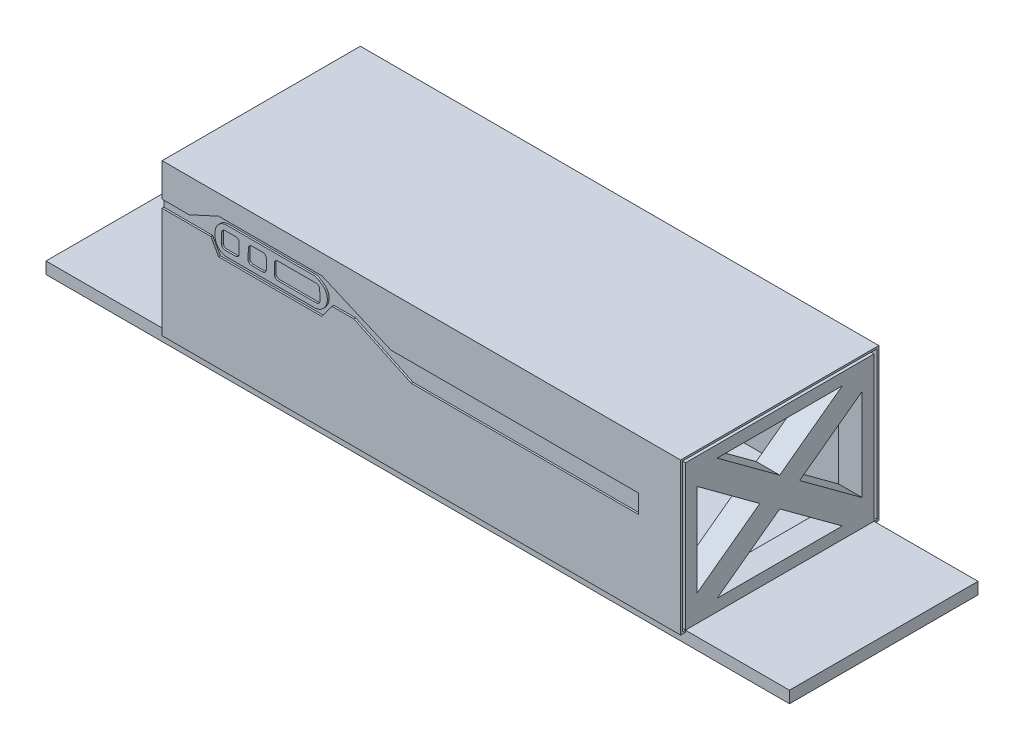
from build123d import *

# Parameters (mm, degrees)
BOSS_EXTRUDE1_DEPTH      = 80
BOSS_EXTRUDE1_DEPTH_BACK = 80
SKETCH7_W                = 630.907220272
SKETCH7_H                = 10
SKETCH11_W               = 20
SKETCH11_H               = 160
BOSS_EXTRUDE2_DEPTH      = 123
CUT_EXTRUDE1_DEPTH       = 20
LPATTERN2_COUNT          = 3
LPATTERN2_PITCH          = 210
THICKEN1_START           = -528.249890188
THICKEN1_DEPTH           = 440
CUT_EXTRUDE2_DEPTH       = 1.5


# Read off the part's stored shape, not the designer's step: Thicken1
with BuildPart() as part:
    # Sketch7 → Boss-Extrude1 (new, two sides: drawn at the far end of the back side and taken through both)
    with BuildSketch(Plane.XY.offset(-BOSS_EXTRUDE1_DEPTH_BACK)):
        with Locations((-315.453610136, 440.692410893)):
            Rectangle(SKETCH7_W, SKETCH7_H)
    extrude(amount=BOSS_EXTRUDE1_DEPTH + BOSS_EXTRUDE1_DEPTH_BACK)

    # Sketch11 → Boss-Extrude2 (add)
    with BuildSketch(Plane(origin=(0, 445.692410893, 0), x_dir=(1, 0, 0), z_dir=(0, 1, 0))):
        with Locations((-98.249890188, 0)):
            Rectangle(SKETCH11_W, SKETCH11_H)
    boss_extrude2 = extrude(amount=BOSS_EXTRUDE2_DEPTH)

    # Sketch22 → Cut-Extrude1 (cut)
    with BuildSketch(Plane(origin=(-88.249890188, 0, 0), x_dir=(0, 0, -1), z_dir=(1, 0, 0))):
        Polygon((16.87450142, 507.192410893), (70, 468.107222652), (70, 546.277599133), align=None)
        Polygon((0, 494.777599133), (-53.12549858, 455.692410893), (53.12549858, 455.692410893), align=None)
        Polygon((53.12549858, 558.692410893), (0, 519.607222652), (-53.12549858, 558.692410893), align=None)
        Polygon((-70, 546.277599133), (-16.87450142, 507.192410893), (-70, 468.107222652), align=None)
    cut_extrude1 = extrude(amount=-CUT_EXTRUDE1_DEPTH, mode=Mode.SUBTRACT)

    # LPattern2: Boss-Extrude2, Cut-Extrude1 ×3
    with Locations(*[(-i * LPATTERN2_PITCH, 0, 0) for i in range(1, LPATTERN2_COUNT)]):
        add(boss_extrude2)
        add(cut_extrude1, mode=Mode.SUBTRACT)

    # Thicken1 outline → Thicken1 (add)
    with BuildSketch(Plane.YZ.offset(THICKEN1_START)):
        Polygon((572.792410893, 84.1), (444.092410893, 84.1), (444.092410893, 80), (445.692410893, 80), (445.692410893, 82.5), (571.192410893, 82.5), (571.192410893, -82.5), (445.692410893, -82.5), (445.692410893, -80), (444.092410893, -80), (444.092410893, -84.1), (572.792410893, -84.1), align=None)
    extrude(amount=THICKEN1_DEPTH)

    # Sketch32 → Cut-Extrude2 (cut)
    # profile 1 of 4: a face of its own
    with BuildSketch(Plane.XY.offset(84.1)):
        Polygon((-528.249890188, 544.469331624), (-528.249890188, 537.802237514), (-486.889483608, 537.802237514), (-480.302440914, 526.060117929), (-392.666133771, 526.060117929), (-384.074338953, 537.802237514), (-365.458783514, 537.802237514), (-316.771946211, 514.890784666), (-123.815009115, 514.890784666), (-123.815009115, 530.653531113), (-334.107361199, 530.653531113), (-392.666133771, 555.945540522), (-480.302440914, 555.945540522), (-505.270533493, 544.469331624), align=None)
        with BuildLine():
            ThreePointArc((-479.595619768, 550.590513801), (-476.634482688, 552.254570361), (-473.28714986, 552.831441214))
            Line((-473.28714986, 552.831441214), (-400.440970209, 552.831441214))
            ThreePointArc((-400.440970209, 552.831441214), (-397.496952722, 552.38825873), (-394.813882632, 551.097993421))
            Line((-394.813882632, 551.097993421), (-392.4594665, 549.495329404))
            ThreePointArc((-392.4594665, 549.495329404), (-389.247128875, 545.90473294), (-388.086554076, 541.228777196))
            Line((-388.086554076, 541.228777196), (-388.086554076, 540.483912543))
            ThreePointArc((-388.086554076, 540.483912543), (-388.52973656, 537.539895057), (-389.820001869, 534.856824966))
            Line((-389.820001869, 534.856824966), (-390.557736537, 533.773045468))
            ThreePointArc((-390.557736537, 533.773045468), (-394.148333001, 530.560707843), (-398.824288745, 529.400133044))
            Line((-398.824288745, 529.400133044), (-473.046485096, 529.400133044))
            ThreePointArc((-473.046485096, 529.400133044), (-477.342721875, 530.370052782), (-480.805557683, 533.091663137))
            Line((-480.805557683, 533.091663137), (-481.107636182, 533.463203151))
            ThreePointArc((-481.107636182, 533.463203151), (-482.771692743, 536.424340231), (-483.348563595, 539.771673059))
            Line((-483.348563595, 539.771673059), (-483.348563595, 542.781509125))
            ThreePointArc((-483.348563595, 542.781509125), (-482.378643857, 547.077745904), (-479.657033503, 550.540581713))
            Line((-479.657033503, 550.540581713), (-479.595619768, 550.590513801))
        make_face(mode=Mode.SUBTRACT)
    # profile 2 of 4: a face of its own
    with BuildSketch(Plane.XY.offset(84.1)):
        with BuildLine():
            ThreePointArc((-462.90275949, 536.708267271), (-463.781439147, 534.586946927), (-465.90275949, 533.708267271))
            Line((-465.90275949, 533.708267271), (-474.804180104, 533.708267271))
            ThreePointArc((-474.804180104, 533.708267271), (-476.925500448, 534.586946927), (-477.804180104, 536.708267271))
            Line((-477.804180104, 536.708267271), (-477.804180104, 545.106288017))
            ThreePointArc((-477.804180104, 545.106288017), (-476.925500448, 547.227608361), (-474.804180104, 548.106288017))
            Line((-474.804180104, 548.106288017), (-465.90275949, 548.106288017))
            ThreePointArc((-465.90275949, 548.106288017), (-463.781439147, 547.227608361), (-462.90275949, 545.106288017))
            Line((-462.90275949, 545.106288017), (-462.90275949, 536.708267271))
        make_face()
    # profile 3 of 4: a face of its own
    with BuildSketch(Plane.XY.offset(84.1)):
        with BuildLine():
            ThreePointArc((-439.852717102, 536.708267271), (-440.731396759, 534.586946927), (-442.852717102, 533.708267271))
            Line((-442.852717102, 533.708267271), (-452.341688786, 533.708267271))
            ThreePointArc((-452.341688786, 533.708267271), (-454.496780659, 534.62126487), (-455.340143394, 536.804547923))
            Line((-455.340143394, 536.804547923), (-455.070482178, 545.20256867))
            ThreePointArc((-455.070482178, 545.20256867), (-454.15902997, 547.26137989), (-452.07202757, 548.106288017))
            Line((-452.07202757, 548.106288017), (-442.852717102, 548.106288017))
            ThreePointArc((-442.852717102, 548.106288017), (-440.731396759, 547.227608361), (-439.852717102, 545.106288017))
            Line((-439.852717102, 545.106288017), (-439.852717102, 536.708267271))
        make_face()
    # profile 4 of 4: a face of its own
    with BuildSketch(Plane.XY.offset(84.1)):
        with BuildLine():
            Line((-430.055327757, 548.106288017), (-397.551516574, 548.106288017))
            ThreePointArc((-397.551516574, 548.106288017), (-395.45785328, 547.254909439), (-394.552523372, 545.184004026))
            Line((-394.552523372, 545.184004026), (-394.334896785, 536.78598328))
            ThreePointArc((-394.334896785, 536.78598328), (-395.185268565, 534.614603977), (-397.333889987, 533.708267271))
            Line((-397.333889987, 533.708267271), (-430.055327757, 533.708267271))
            ThreePointArc((-430.055327757, 533.708267271), (-432.1766481, 534.586946927), (-433.055327757, 536.708267271))
            Line((-433.055327757, 536.708267271), (-433.055327757, 545.106288017))
            ThreePointArc((-433.055327757, 545.106288017), (-432.1766481, 547.227608361), (-430.055327757, 548.106288017))
        make_face()
    cut_extrude2 = extrude(amount=-CUT_EXTRUDE2_DEPTH, mode=Mode.SUBTRACT)

    # Mirror1: Cut-Extrude2 across plane
    add(cut_extrude2.mirror(Plane.XY), mode=Mode.SUBTRACT)


solid = part.part
